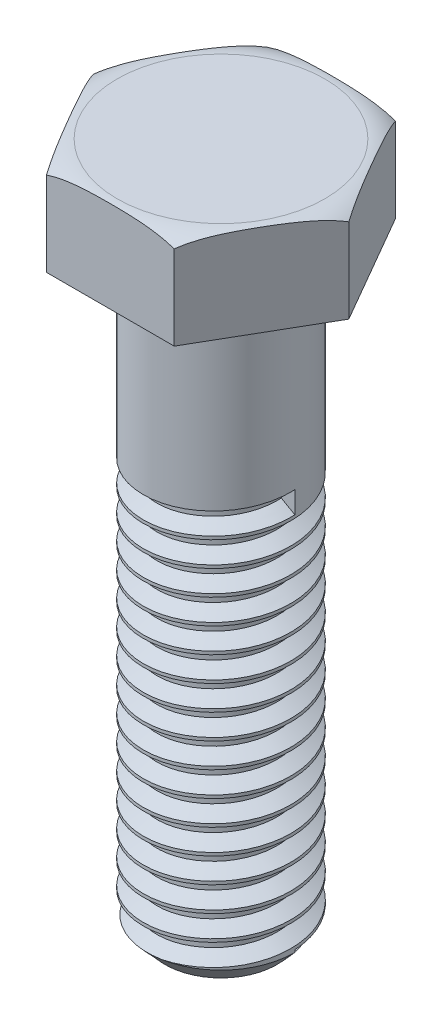
from build123d import *

# Parameters (mm, degrees)
BOSS_EXTRUDE1_DEPTH = 43.8023
SKETCH2_R           = 4.70535
CUT_EXTRUDE1_DEPTH  = 37.9222
THREAD1_PITCH       = 1.5875


with BuildPart() as part:
    # Sketch1 → Boss-Extrude1 (new body)
    with BuildSketch(Plane(origin=(0, 0, 0), x_dir=(1, 0, 0), z_dir=(0, 1, 0))):
        Polygon((8.146239093, 0), (4.073119547, 7.05485), (-4.073119547, 7.05485), (-8.146239093, 0), (-4.073119547, -7.05485), (4.073119547, -7.05485), align=None)
    extrude(amount=-BOSS_EXTRUDE1_DEPTH)

    # Sketch2 → Cut-Extrude1 (cut)
    with BuildSketch(Plane.XZ.offset(43.8023)):
        Polygon((-8.146239093, 0), (-4.073119547, 7.05485), (4.073119547, 7.05485), (8.146239093, 0), (4.073119547, -7.05485), (-4.073119547, -7.05485), align=None)
        with Locations(Location((0, 0, 0), (0, 0, 270))):
            Circle(SKETCH2_R, mode=Mode.SUBTRACT)
    extrude(amount=-CUT_EXTRUDE1_DEPTH, mode=Mode.SUBTRACT)

    # Thread1: the profile of Thread Profile1 profile screwed along a right-hand helix of 16 turns, 8 arcs to a turn; built about Z, then put on its axis
    thread1_z = Axis((0, 0, 0), (0, 0, 1))
    thread1_corners = [(4.70565, 0, -0.000173205), (4.70565, 0, 1.389235701), (3.846090423, 0, 0.892968748), (3.846090423, 0, 0.496093748)]
    with BuildLine(mode=Mode.PRIVATE) as thread1_profile:
        Line(thread1_corners[0], thread1_corners[1])
        Line(thread1_corners[1], thread1_corners[2])
        Line(thread1_corners[2], thread1_corners[3])
        Line(thread1_corners[3], thread1_corners[0])
    thread1_cap = Face(thread1_profile.wire())
    thread1_turn_angles = [0, 22.5, 45, 67.5, 90, 112.5, 135, 157.5, 180, 202.5, 225, 247.5, 270, 292.5, 315, 337.5, 360]
    thread1_turn_weights = [1, 0.9238795325112867, 1, 0.9238795325112867, 1, 0.9238795325112867, 1, 0.9238795325112867, 1, 0.9238795325112867, 1, 0.9238795325112867, 1, 0.9238795325112867, 1, 0.9238795325112867, 1]
    thread1_turn_rails = [Edge.make_bspline([Vector(p[0], p[1], 0).rotate(thread1_z, thread1_turn_angles[k]) / thread1_turn_weights[k] + Vector(0, 0, p[2] + THREAD1_PITCH * thread1_turn_angles[k] / 360) for k in range(17)], [0, 0, 0, 1, 1, 2, 2, 3, 3, 4, 4, 5, 5, 6, 6, 7, 7, 8, 8, 8], 2, thread1_turn_weights) for p in thread1_corners]
    thread1_turn_sides = [Face.make_surface_from_curves(thread1_turn_rails[p[0]], thread1_turn_rails[p[1]]) for p in [(0, 1), (1, 2), (2, 3), (3, 0)]]
    thread1 = Plane(origin=(0, -43.8023, 0), x_dir=(1, 0, 0), z_dir=(0, 1, 0)) * Solid(Shell([*[p.moved(Location((0, 0, THREAD1_PITCH * i))) for i in range(16) for p in thread1_turn_sides], thread1_cap, thread1_cap.rotate(thread1_z, 5760).moved(Location((0, 0, THREAD1_PITCH * 5760 / 360)))]))
    add(thread1, mode=Mode.SUBTRACT)

    # Sketch8 → Cut-Revolve2 (revolve, cut)
    with BuildSketch(Plane.XY, mode=Mode.PRIVATE) as cut_revolve2_sk:
        Polygon((3.037320372, -43.8023), (2.896582223, -43.661561851), (0, -43.661561851), (0, -43.8023), align=None)
        Polygon((3.569558995, -43.8023), (5.296619017, -41.923643222), (5.296619017, -43.8023), align=None)
    revolve(cut_revolve2_sk.sketch.rotate(Axis((0, -44.394767863, 0), (0, 1, 0)), 90), axis=Axis((0, -44.394767863, 0), (0, 1, 0)), mode=Mode.SUBTRACT)

    # Sketch9 → Cut-Revolve4 (revolve, cut)
    with BuildSketch(Plane.XY, mode=Mode.PRIVATE) as cut_revolve4_sk:
        with BuildLine():
            Line((6.622239093, 0), (8.146239093, 0))
            Line((8.146239093, 0), (8.146239093, -0.508))
            ThreePointArc((8.146239093, -0.508), (7.420728079, -0.144533041), (6.622239093, 0))
        make_face()
    revolve(cut_revolve4_sk.sketch.rotate(Axis((0, 2.564455621, 0), (0, -1, 0)), 270), axis=Axis((0, 2.564455621, 0), (0, -1, 0)), mode=Mode.SUBTRACT)


solid = part.part
